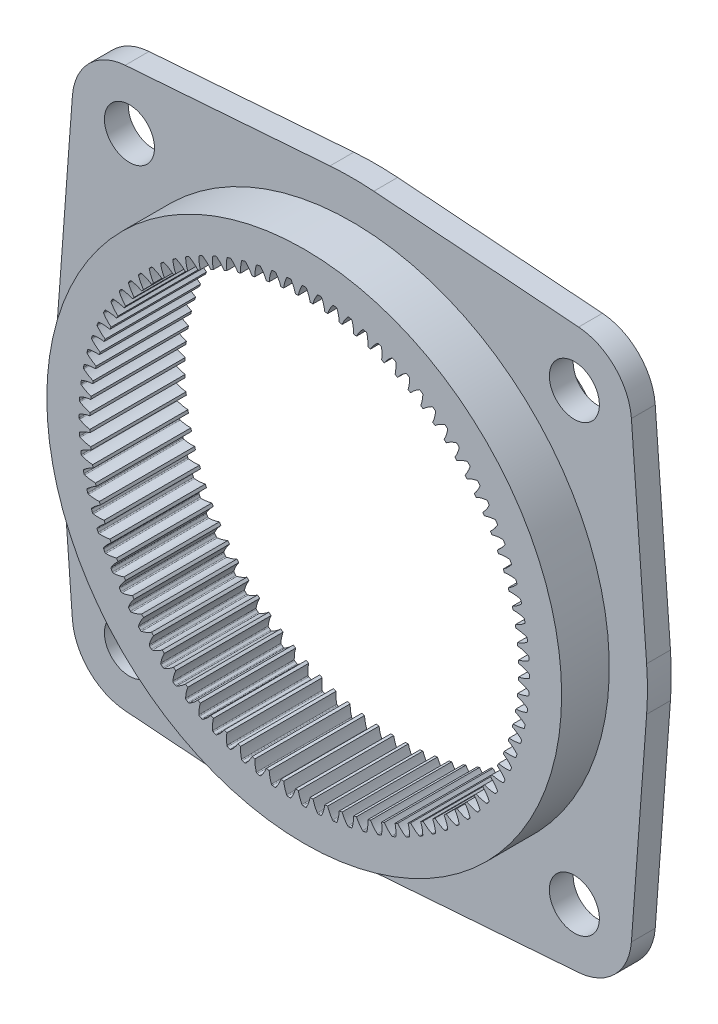
from build123d import *

# Parameters (mm, degrees)
ESQUISSE3_R                  = 45
ESQUISSE3_R_2                = 5.25
BASE_EXTRUSION_DEPTH         = 20
ESQUISSE4_W                  = 36.998365855
ESQUISSE4_H                  = 8.085427136
ESQUISSE4_H_2                = 13.085427136
ENL_V_START                  = -20
ENL_V_MAT_EXTRU_1_DEPTH      = 20
R_P_TITION_CIRCULAIRE1_COUNT = 92


with BuildPart() as part:
    # Esquisse3 → Base-Extrusion (new body)
    with BuildSketch(Plane.XY):
        with BuildLine():
            Line((-61.829435635, 4.59574684), (-58.636035101, 47.558546947))
            ThreePointArc((-58.636035101, 47.558546947), (-55.154328933, 55.154328933), (-47.558546947, 58.636035101))
            Line((-47.558546947, 58.636035101), (-4.59574684, 61.829435635))
            ThreePointArc((-4.59574684, 61.829435635), (0, 62), (4.59574684, 61.829435635))
            Line((4.59574684, 61.829435635), (47.558546947, 58.636035101))
            ThreePointArc((47.558546947, 58.636035101), (55.154328933, 55.154328933), (58.636035101, 47.558546947))
            Line((58.636035101, 47.558546947), (61.829435635, 4.59574684))
            ThreePointArc((61.829435635, 4.59574684), (62, 0), (61.829435635, -4.59574684))
            Line((61.829435635, -4.59574684), (58.636035101, -47.558546947))
            ThreePointArc((58.636035101, -47.558546947), (55.154328933, -55.154328933), (47.558546947, -58.636035101))
            Line((47.558546947, -58.636035101), (4.59574684, -61.829435635))
            ThreePointArc((4.59574684, -61.829435635), (0, -62), (-4.59574684, -61.829435635))
            Line((-4.59574684, -61.829435635), (-47.558546947, -58.636035101))
            ThreePointArc((-47.558546947, -58.636035101), (-55.154328933, -55.154328933), (-58.636035101, -47.558546947))
            Line((-58.636035101, -47.558546947), (-61.829435635, -4.59574684))
            ThreePointArc((-61.829435635, -4.59574684), (-62, 0), (-61.829435635, 4.59574684))
        make_face()
        Circle(ESQUISSE3_R, mode=Mode.SUBTRACT)
        with Locations(Location((46.669047558, 46.669047558, 0), (0, 0, 180))):
            Circle(ESQUISSE3_R_2, mode=Mode.SUBTRACT)
        with Locations(Location((-46.669047558, 46.669047558, 0), (0, 0, 180))):
            Circle(ESQUISSE3_R_2, mode=Mode.SUBTRACT)
        with Locations(Location((-46.669047558, -46.669047558, 0), (0, 0, 180))):
            Circle(ESQUISSE3_R_2, mode=Mode.SUBTRACT)
        with Locations(Location((46.669047558, -46.669047558, 0), (0, 0, 180))):
            Circle(ESQUISSE3_R_2, mode=Mode.SUBTRACT)
    extrude(amount=BASE_EXTRUSION_DEPTH)

    # Esquisse4 → Enlèvement de matière-Révolution1 (revolve, cut)
    with BuildSketch(Plane(origin=(0, 0, 0), x_dir=(1, 0, 0), z_dir=(0, 1, 0)), mode=Mode.PRIVATE) as enl_vement_de_mati_re_r_volution1_sk:
        with Locations((72.499182928, -0.957286432)):
            Rectangle(ESQUISSE4_W, ESQUISSE4_H)
        with Locations((72.499182928, -16.542713568)):
            Rectangle(ESQUISSE4_W, ESQUISSE4_H_2)
    revolve(enl_vement_de_mati_re_r_volution1_sk.sketch.rotate(Axis((0, 0, -12.639865997), (0, 0, 1)), 180), axis=Axis((0, 0, -12.639865997), (0, 0, 1)), mode=Mode.SUBTRACT)

    # Esquisse5 → Enlèv. mat.-Extru.1 (cut)
    with BuildSketch(Plane.XY.offset(20).offset(ENL_V_START)):
        with BuildLine():
            ThreePointArc((1.23649071, 44.983008911), (0, 45), (-1.23649071, 44.983008911))
            ThreePointArc((-1.23649071, 44.983008911), (-0.940748363, 46.08240654), (-0.472504766, 47.120138016))
            ThreePointArc((-0.472504766, 47.120138016), (-0.381291739, 47.214268948), (-0.254988786, 47.24931196))
            ThreePointArc((-0.254988786, 47.24931196), (0, 47.25), (0.254988786, 47.24931196))
            ThreePointArc((0.254988786, 47.24931196), (0.381291739, 47.214268948), (0.472504766, 47.120138016))
            ThreePointArc((0.472504766, 47.120138016), (0.940748363, 46.08240654), (1.23649071, 44.983008911))
        make_face()
    enl_v_mat_extru_1 = extrude(amount=ENL_V_MAT_EXTRU_1_DEPTH, mode=Mode.SUBTRACT)

    # Répétition circulaire1: Enlèv. mat.-Extru.1 ×92 about axis
    r_p_tition_circulaire1_axis = Axis((0, 0, 0), (0, 0, -1))
    for i in range(1, R_P_TITION_CIRCULAIRE1_COUNT):
        add(enl_v_mat_extru_1.rotate(r_p_tition_circulaire1_axis, i * 360 / R_P_TITION_CIRCULAIRE1_COUNT), mode=Mode.SUBTRACT)


solid = part.part
